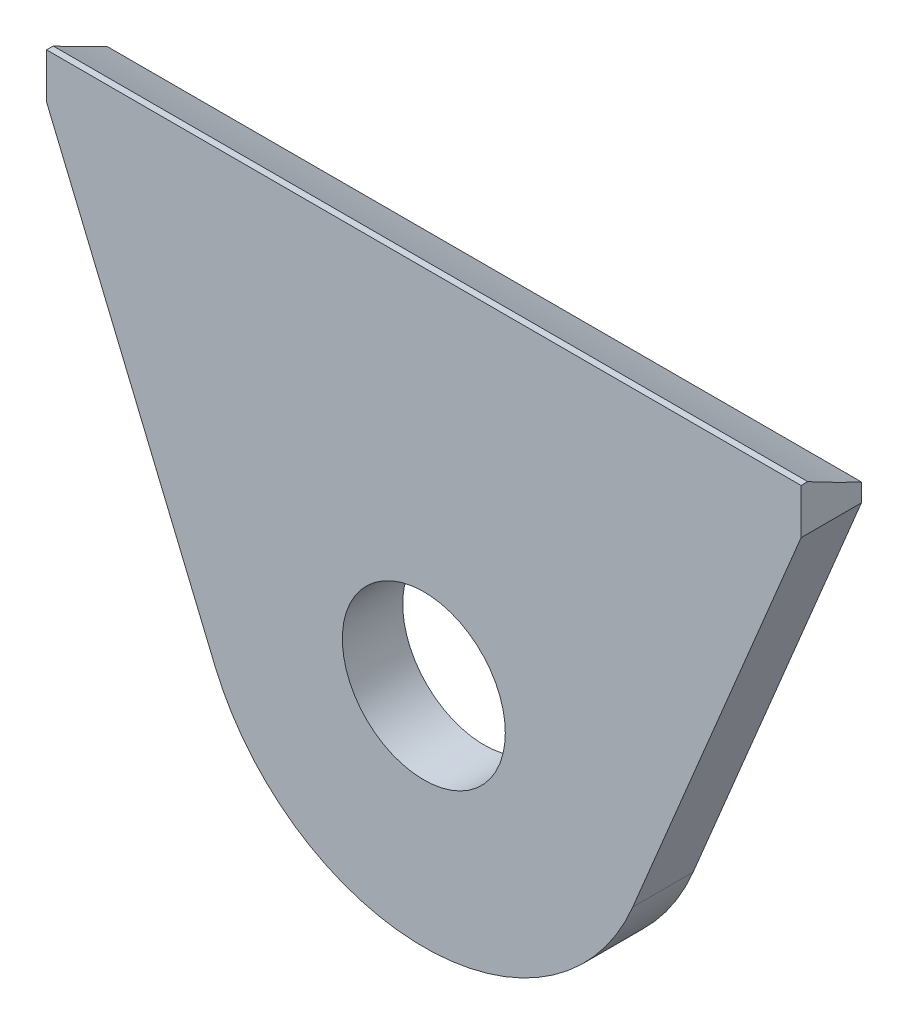
from build123d import *

# Parameters (mm, degrees)
SKETCH_1_R                 = 5.4
EXTRUDE_1_DEPTH            = 4
CUT_EXTRUDE_534_DEPTH      = 35.885527085
CUT_EXTRUDE_534_DEPTH_BACK = 35.885527085
SKETCH_514_R               = 70.5


with BuildPart() as part:
    # Эскиз1 → Бобышка-Вытянуть1 (new body)
    with BuildSketch(Plane.XY):
        with BuildLine():
            Line((-25, 24), (25, 24))
            Line((25, 24), (25, 21))
            Line((25, 21), (13.846153846, -5.769230769))
            ThreePointArc((13.846153846, -5.769230769), (0, -15), (-13.846153846, -5.769230769))
            Line((-13.846153846, -5.769230769), (-25, 21))
            Line((-25, 21), (-25, 24))
        make_face()
        Circle(SKETCH_1_R, mode=Mode.SUBTRACT)
    extrude(amount=EXTRUDE_1_DEPTH)

    # Sketch 514 → Cut-Extrude 534 (cut, two sides: drawn at the far end of the back side and taken through both)
    with BuildSketch(Plane(origin=(0, 0, 0), x_dir=(0, 0, -1), z_dir=(1, 0, 0)).offset(-CUT_EXTRUDE_534_DEPTH_BACK)):
        with Locations((30, 86)):
            Circle(SKETCH_514_R)
    extrude(amount=CUT_EXTRUDE_534_DEPTH + CUT_EXTRUDE_534_DEPTH_BACK, mode=Mode.SUBTRACT)


solid = part.part
